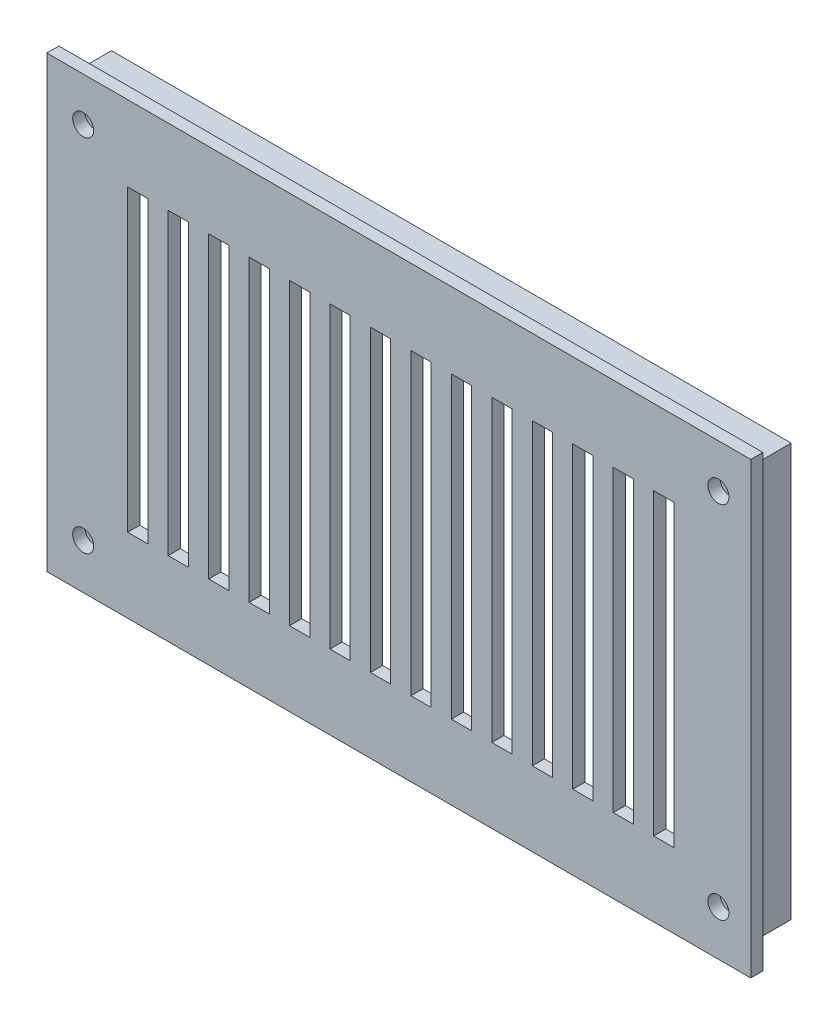
from build123d import *

# Parameters (mm, degrees)
SKETCH1_W           = 174
SKETCH1_H           = 111
SKETCH1_R           = 2.6
SKETCH1_W_2         = 5
SKETCH1_H_2         = 73.910542587
BOSS_EXTRUDE1_DEPTH = 1.5
SKETCH2_R           = 3.25
SKETCH2_R_2         = 1.25
BOSS_EXTRUDE2_DEPTH = 5
SKETCH3_W           = 168
SKETCH3_H           = 102
SKETCH3_W_2         = 166
SKETCH3_H_2         = 100
BOSS_EXTRUDE3_DEPTH = 10
FILLET1_R           = 4


with BuildPart() as part:
    # Sketch1 → Boss-Extrude1 (new, symmetric)
    with BuildSketch(Plane.XY):
        Rectangle(SKETCH1_W, SKETCH1_H)
        with Locations((-78, -44.3)):
            Circle(SKETCH1_R, mode=Mode.SUBTRACT)
        with Locations((-78, 44.7)):
            Circle(SKETCH1_R, mode=Mode.SUBTRACT)
        with Locations((79, 44.7)):
            Circle(SKETCH1_R, mode=Mode.SUBTRACT)
        with Locations((79, -44.3)):
            Circle(SKETCH1_R, mode=Mode.SUBTRACT)
        with Locations((-54.5, -0.133320073)):
            Rectangle(SKETCH1_W_2, SKETCH1_H_2, mode=Mode.SUBTRACT)
        with Locations((-64.5, -0.133320073)):
            Rectangle(SKETCH1_W_2, SKETCH1_H_2, mode=Mode.SUBTRACT)
        with Locations((-44.5, -0.133320073)):
            Rectangle(SKETCH1_W_2, SKETCH1_H_2, mode=Mode.SUBTRACT)
        with Locations((-34.5, -0.133320073)):
            Rectangle(SKETCH1_W_2, SKETCH1_H_2, mode=Mode.SUBTRACT)
        with Locations((-24.5, -0.133320073)):
            Rectangle(SKETCH1_W_2, SKETCH1_H_2, mode=Mode.SUBTRACT)
        with Locations((-14.5, -0.133320073)):
            Rectangle(SKETCH1_W_2, SKETCH1_H_2, mode=Mode.SUBTRACT)
        with Locations((-4.5, -0.133320073)):
            Rectangle(SKETCH1_W_2, SKETCH1_H_2, mode=Mode.SUBTRACT)
        with Locations((5.5, -0.133320073)):
            Rectangle(SKETCH1_W_2, SKETCH1_H_2, mode=Mode.SUBTRACT)
        with Locations((15.5, -0.133320073)):
            Rectangle(SKETCH1_W_2, SKETCH1_H_2, mode=Mode.SUBTRACT)
        with Locations((25.5, -0.133320073)):
            Rectangle(SKETCH1_W_2, SKETCH1_H_2, mode=Mode.SUBTRACT)
        with Locations((35.5, -0.133320073)):
            Rectangle(SKETCH1_W_2, SKETCH1_H_2, mode=Mode.SUBTRACT)
        with Locations((45.5, -0.133320073)):
            Rectangle(SKETCH1_W_2, SKETCH1_H_2, mode=Mode.SUBTRACT)
        with Locations((55.5, -0.133320073)):
            Rectangle(SKETCH1_W_2, SKETCH1_H_2, mode=Mode.SUBTRACT)
        with Locations((65.5, -0.133320073)):
            Rectangle(SKETCH1_W_2, SKETCH1_H_2, mode=Mode.SUBTRACT)
    extrude(amount=BOSS_EXTRUDE1_DEPTH, both=True)

    # Sketch2 → Boss-Extrude2 (add)
    # profile 1 of 4: a face of its own
    with BuildSketch(Plane(origin=(0, 0, -1.5), x_dir=(-1, 0, 0), z_dir=(0, 0, -1))):
        with Locations(Location((-79, 44.7, 0), (0, 0, 180))):
            Circle(SKETCH2_R)
        with Locations((-79, 44.7)):
            Circle(SKETCH2_R_2, mode=Mode.SUBTRACT)
    # profile 2 of 4: a face of its own
    with BuildSketch(Plane(origin=(0, 0, -1.5), x_dir=(-1, 0, 0), z_dir=(0, 0, -1))):
        with Locations(Location((-79, -44.3, 0), (0, 0, 180))):
            Circle(SKETCH2_R)
        with Locations((-79, -44.3)):
            Circle(SKETCH2_R_2, mode=Mode.SUBTRACT)
    # profile 3 of 4: a face of its own
    with BuildSketch(Plane(origin=(0, 0, -1.5), x_dir=(-1, 0, 0), z_dir=(0, 0, -1))):
        with Locations(Location((78, 44.7, 0), (0, 0, 180))):
            Circle(SKETCH2_R)
        with Locations((78, 44.7)):
            Circle(SKETCH2_R_2, mode=Mode.SUBTRACT)
    # profile 4 of 4: a face of its own
    with BuildSketch(Plane(origin=(0, 0, -1.5), x_dir=(-1, 0, 0), z_dir=(0, 0, -1))):
        with Locations(Location((78, -44.3, 0), (0, 0, 180))):
            Circle(SKETCH2_R)
        with Locations((78, -44.3)):
            Circle(SKETCH2_R_2, mode=Mode.SUBTRACT)
    extrude(amount=BOSS_EXTRUDE2_DEPTH)

    # Sketch3 → Boss-Extrude3 (add)
    with BuildSketch(Plane(origin=(0, 0, -1.5), x_dir=(-1, 0, 0), z_dir=(0, 0, -1))):
        Rectangle(SKETCH3_W, SKETCH3_H)
        Rectangle(SKETCH3_W_2, SKETCH3_H_2, mode=Mode.SUBTRACT)
    extrude(amount=BOSS_EXTRUDE3_DEPTH)

    # Fillet1
    # the kernel refuses this fillet: 4 mm, written as the material it adds along each edge
    with BuildSketch(Plane(origin=(79, 44.7, -1.5), x_dir=(1, 0, 0), z_dir=(0, 1, 0))) as fillet1_piece_1_section:
        with BuildLine():
            CenterArc((3.25 + FILLET1_R, FILLET1_R), FILLET1_R, 180, 90)
            Line((3.25, FILLET1_R), (3.25, 0))
            Line((3.25, 0), (3.25 + FILLET1_R, 0))
        make_face()
    fillet1_piece_1 = revolve(axis=Axis((79, 44.7, -1.5), (0, 0, -1)), mode=Mode.PRIVATE)
    fillet1_piece_1 = split(fillet1_piece_1, bisect_by=Plane(origin=(74.608842471, 50, -2.641157529), z_dir=(0, -1, 0)), keep=Keep.TOP, mode=Mode.PRIVATE)
    fillet1_piece_1 = split(fillet1_piece_1, bisect_by=Plane(origin=(83, 44.7, -2.641157529), z_dir=(-1, 0, 0)), keep=Keep.TOP, mode=Mode.PRIVATE)
    add(fillet1_piece_1)
    with BuildSketch(Plane(origin=(79, -44.3, -1.5), x_dir=(1, 0, 0), z_dir=(0, 1, 0))) as fillet1_piece_2_section:
        with BuildLine():
            CenterArc((3.25 + FILLET1_R, FILLET1_R), FILLET1_R, 180, 90)
            Line((3.25, FILLET1_R), (3.25, 0))
            Line((3.25, 0), (3.25 + FILLET1_R, 0))
        make_face()
    fillet1_piece_2 = revolve(axis=Axis((79, -44.3, -1.5), (0, 0, -1)), mode=Mode.PRIVATE)
    fillet1_piece_2 = split(fillet1_piece_2, bisect_by=Plane(origin=(83, -44.3, -2.641059385), z_dir=(-1, 0, 0)), keep=Keep.TOP, mode=Mode.PRIVATE)
    fillet1_piece_2 = split(fillet1_piece_2, bisect_by=Plane(origin=(74.608940615, -50, -2.641059385), z_dir=(0, 1, 0)), keep=Keep.TOP, mode=Mode.PRIVATE)
    add(fillet1_piece_2)
    with BuildSketch(Plane(origin=(-78, 44.7, -1.5), x_dir=(1, 0, 0), z_dir=(0, 1, 0))) as fillet1_piece_3_section:
        with BuildLine():
            CenterArc((3.25 + FILLET1_R, FILLET1_R), FILLET1_R, 180, 90)
            Line((3.25, FILLET1_R), (3.25, 0))
            Line((3.25, 0), (3.25 + FILLET1_R, 0))
        make_face()
    fillet1_piece_3 = revolve(axis=Axis((-78, 44.7, -1.5), (0, 0, -1)), mode=Mode.PRIVATE)
    fillet1_piece_3 = split(fillet1_piece_3, bisect_by=Plane(origin=(-82.390403008, 50, -2.640403008), z_dir=(0, -1, 0)), keep=Keep.TOP, mode=Mode.PRIVATE)
    fillet1_piece_3 = split(fillet1_piece_3, bisect_by=Plane(origin=(-83, 44.7, -2.640403008), z_dir=(1, 0, 0)), keep=Keep.TOP, mode=Mode.PRIVATE)
    add(fillet1_piece_3)
    with BuildSketch(Plane(origin=(-78, -44.3, -1.5), x_dir=(1, 0, 0), z_dir=(0, 1, 0))) as fillet1_piece_4_section:
        with BuildLine():
            CenterArc((3.25 + FILLET1_R, FILLET1_R), FILLET1_R, 180, 90)
            Line((3.25, FILLET1_R), (3.25, 0))
            Line((3.25, 0), (3.25 + FILLET1_R, 0))
        make_face()
    fillet1_piece_4 = revolve(axis=Axis((-78, -44.3, -1.5), (0, 0, -1)), mode=Mode.PRIVATE)
    fillet1_piece_4 = split(fillet1_piece_4, bisect_by=Plane(origin=(-82.390309195, -50, -2.640309195), z_dir=(0, 1, 0)), keep=Keep.TOP, mode=Mode.PRIVATE)
    fillet1_piece_4 = split(fillet1_piece_4, bisect_by=Plane(origin=(-83, -44.3, -2.640309195), z_dir=(1, 0, 0)), keep=Keep.TOP, mode=Mode.PRIVATE)
    add(fillet1_piece_4)


solid = part.part
